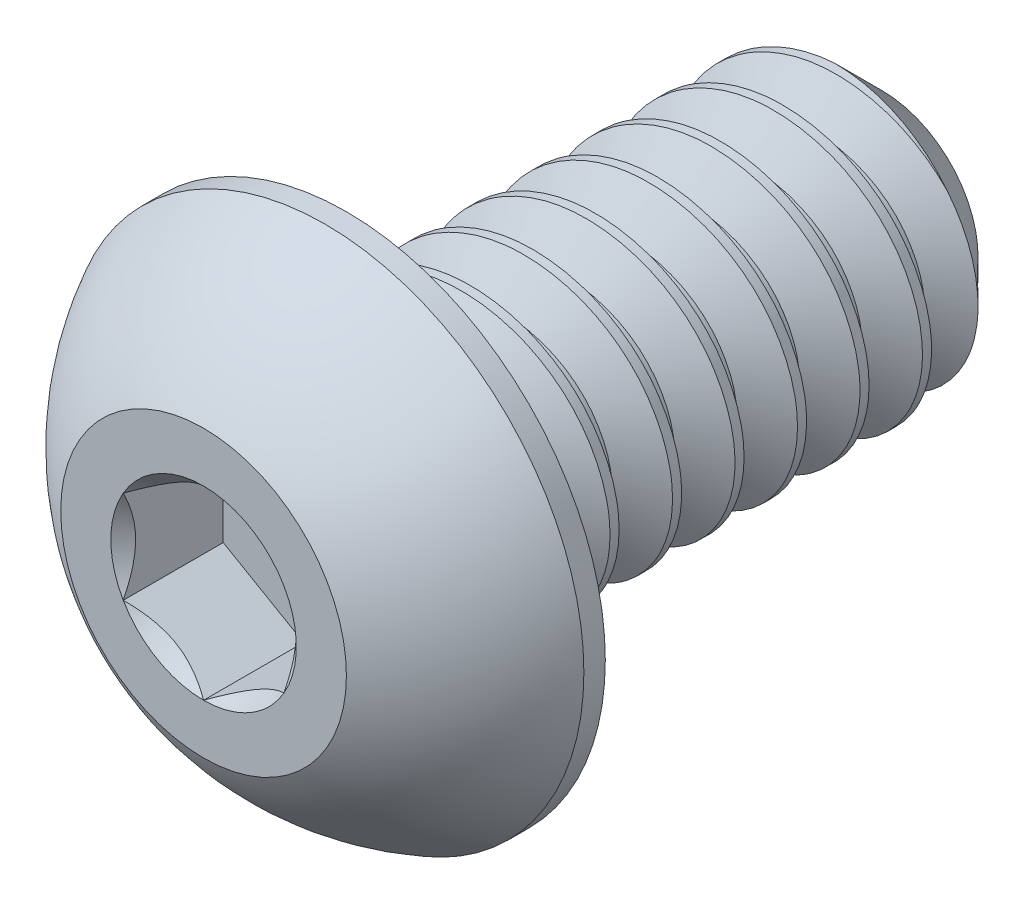
from build123d import *

# Parameters (mm, degrees)
SKETCH1_W          = 3
SKETCH1_H          = 0.8
CHAMFER1_SIZE      = 0.2625
CUT_EXTRUDE2_DEPTH = 0.56
CUT_SWEEP1_PITCH   = 0.35


with BuildPart() as part:
    # Sketch1 → Revolve1 (revolve)
    with BuildSketch(Plane(origin=(0, 0, 0), x_dir=(0, 0, -1), z_dir=(1, 0, 0))):
        with Locations((2.3, 0.4)):
            Rectangle(SKETCH1_W, SKETCH1_H)
    revolve(axis=Axis((0, 0, -3.8), (0, 0, 1)))

    # Chamfer1
    chamfer1_edges = [part.edges().sort_by_distance(p)[0] for p in [
        (0, -0.8, -3.8),
    ]]
    chamfer(chamfer1_edges, length=CHAMFER1_SIZE)

    # Sketch7 → Revolve2 (revolve)
    with BuildSketch(Plane(origin=(0, 0, 0), x_dir=(0, 0, -1), z_dir=(1, 0, 0)), mode=Mode.PRIVATE) as revolve2_sk:
        with BuildLine():
            Line((0.68, 1.45), (0.8, 1.45))
            Line((0.8, 1.45), (0.8, 0))
            Line((0.8, 0), (0, 0))
            Line((0, 0), (0, 0.8))
            ThreePointArc((0, 0.8), (0.291961854, 1.175255291), (0.68, 1.45))
        make_face()
    revolve(revolve2_sk.sketch.rotate(Axis((0, 0, 0), (0, 0, -1)), 180), axis=Axis((0, 0, 0), (0, 0, -1)))

    # Sketch5 → Cut-Extrude2 (cut)
    with BuildSketch(Plane.XY):
        Polygon((0.45, -0.259807621), (0.45, 0.259807621), (0, 0.519615242), (-0.45, 0.259807621), (-0.45, -0.259807621), (0, -0.519615242), align=None)
    extrude(amount=-CUT_EXTRUDE2_DEPTH, mode=Mode.SUBTRACT)

    # Cut-Extrude3 cone 1 section (through the dimple's axis) → Cut-Extrude3 (revolve, cut)
    with BuildSketch(Plane(origin=(0, 0, 0), x_dir=(0, -1, 0), z_dir=(1, 0, 0))):
        Polygon((0, 0), (0.519615242, 0), (0, 0.519615242), align=None)
    revolve(axis=Axis((0, 0, 0), (0, 0, -1)), mode=Mode.SUBTRACT)

    # Cut-Sweep1: the profile of Sketch2 profile screwed along a right-hand helix of 9.571429 turns, 6 arcs to a turn; built about Z, then put on its axis
    cut_sweep1_z = Axis((0, 0, 0), (0, 0, 1))
    cut_sweep1_corners = [(0.8003, 0, 0.262673205), (0.8003, 0, -0.036923205), (0.584792687, 0, 0.0875), (0.584792687, 0, 0.13825)]
    with BuildLine(mode=Mode.PRIVATE) as cut_sweep1_profile:
        Line(cut_sweep1_corners[0], cut_sweep1_corners[1])
        Line(cut_sweep1_corners[1], cut_sweep1_corners[2])
        Line(cut_sweep1_corners[2], cut_sweep1_corners[3])
        Line(cut_sweep1_corners[3], cut_sweep1_corners[0])
    cut_sweep1_cap = Face(cut_sweep1_profile.wire())
    cut_sweep1_turn_angles = [0, 30, 60, 90, 120, 150, 180, 210, 240, 270, 300, 330, 360]
    cut_sweep1_turn_weights = [1, 0.8660254037844387, 1, 0.8660254037844387, 1, 0.8660254037844387, 1, 0.8660254037844387, 1, 0.8660254037844387, 1, 0.8660254037844387, 1]
    cut_sweep1_turn_rails = [Edge.make_bspline([Vector(p[0], p[1], 0).rotate(cut_sweep1_z, cut_sweep1_turn_angles[k]) / cut_sweep1_turn_weights[k] + Vector(0, 0, p[2] + CUT_SWEEP1_PITCH * cut_sweep1_turn_angles[k] / 360) for k in range(13)], [0, 0, 0, 1, 1, 2, 2, 3, 3, 4, 4, 5, 5, 6, 6, 6], 2, cut_sweep1_turn_weights) for p in cut_sweep1_corners]
    cut_sweep1_turn_sides = [Face.make_surface_from_curves(cut_sweep1_turn_rails[p[0]], cut_sweep1_turn_rails[p[1]]) for p in [(0, 1), (1, 2), (2, 3), (3, 0)]]
    cut_sweep1_last_angles = [3240, 3270, 3300, 3330, 3360, 3390, 3420, 3432.857142857, 3445.714285714]
    cut_sweep1_last_weights = [1, 0.8660254037844387, 1, 0.8660254037844387, 1, 0.8660254037844387, 1, 0.9749279121818456, 1]
    cut_sweep1_last_rails = [Edge.make_bspline([Vector(p[0], p[1], 0).rotate(cut_sweep1_z, cut_sweep1_last_angles[k]) / cut_sweep1_last_weights[k] + Vector(0, 0, p[2] + CUT_SWEEP1_PITCH * cut_sweep1_last_angles[k] / 360) for k in range(9)], [0, 0, 0, 1, 1, 2, 2, 3, 3, 4, 4, 4], 2, cut_sweep1_last_weights) for p in cut_sweep1_corners]
    cut_sweep1_last_sides = [Face.make_surface_from_curves(cut_sweep1_last_rails[p[0]], cut_sweep1_last_rails[p[1]]) for p in [(0, 1), (1, 2), (2, 3), (3, 0)]]
    cut_sweep1 = Plane(origin=(0, 0, -3.8), x_dir=(0, 1, 0), z_dir=(0, 0, 1)) * Solid(Shell([*[p.moved(Location((0, 0, CUT_SWEEP1_PITCH * i))) for i in range(9) for p in cut_sweep1_turn_sides], *cut_sweep1_last_sides, cut_sweep1_cap, cut_sweep1_cap.rotate(cut_sweep1_z, 3445.714285714).moved(Location((0, 0, CUT_SWEEP1_PITCH * 3445.714285714 / 360)))]))
    add(cut_sweep1, mode=Mode.SUBTRACT)


solid = part.part
